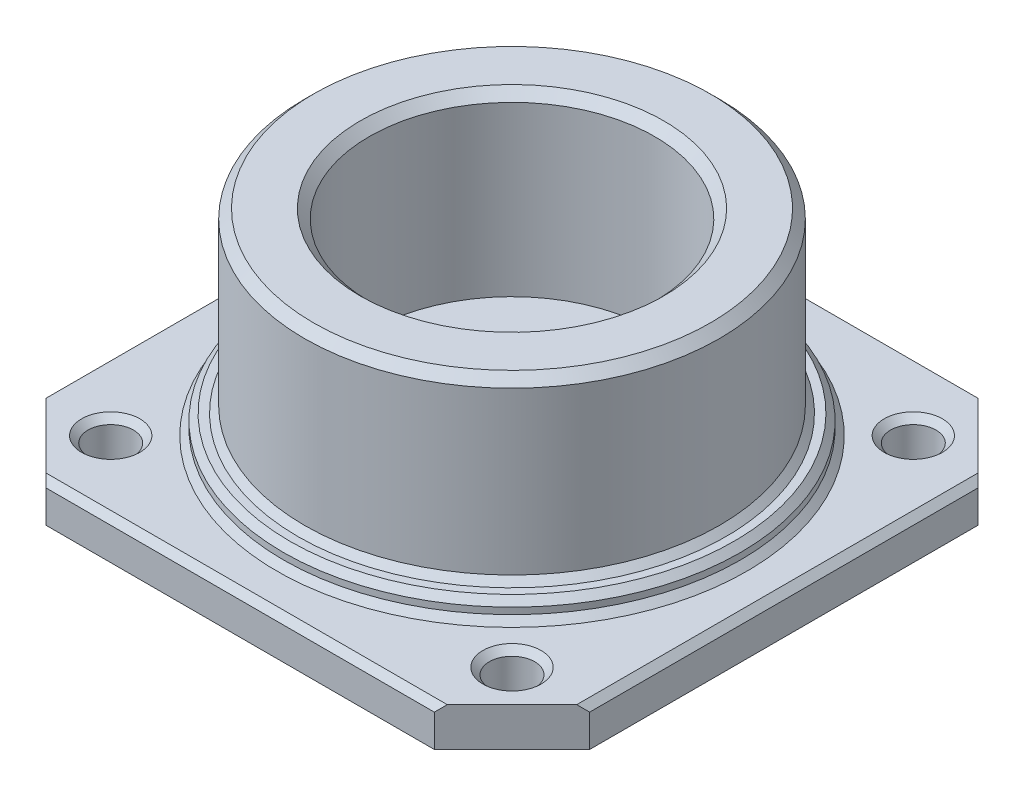
from build123d import *

# Parameters (mm, degrees)
SKETCH_1_W          = 42
SKETCH_1_H          = 42
SKETCH_1_R          = 12.65
SKETCH_1_R_2        = 1.75
EXTRUDE_1_DEPTH     = 2
SKETCH_2_R          = 17.65
SKETCH_2_R_2        = 12.65
EXTRUDE_2_DEPTH     = 0.1
SKETCH_3_R          = 17.65
SKETCH_3_R_2        = 12.65
SKETCH_3_R_3        = 11.025
SKETCH_3_R_4        = 3.95
EXTRUDE_3_DEPTH     = 1.4
SKETCH_4_R          = 16.025
SKETCH_4_R_2        = 11.025
EXTRUDE_4_DEPTH     = 14
CHAMFER_2_SIZE      = 0.5
CHAMFER_3_SIZE      = 1
CHAMFER_4_SIZE      = 6
SKETCH_5_W          = 78.516665661
SKETCH_5_H          = 56.486058674
CUT_EXTRUDE_1_DEPTH = 0.3
EXTRUDE_START       = 1
SKETCH_7_R          = 1.75
SKETCH_7_R_2        = 12.65
EXTRUDE_5_DEPTH     = 1


with BuildPart() as part:
    # 草图1 → 凸台-拉伸1 (new body)
    with BuildSketch(Plane(origin=(0, 0, 0), x_dir=(1, 0, 0), z_dir=(0, 1, 0))):
        Rectangle(SKETCH_1_W, SKETCH_1_H)
        with Locations(Location((0, 0, 0), (0, 0, 270))):
            Circle(SKETCH_1_R, mode=Mode.SUBTRACT)
        with Locations(Location((-15.5, 15.5, 0), (0, 0, 270))):
            Circle(SKETCH_1_R_2, mode=Mode.SUBTRACT)
        with Locations(Location((15.5, 15.5, 0), (0, 0, 270))):
            Circle(SKETCH_1_R_2, mode=Mode.SUBTRACT)
        with Locations(Location((15.5, -15.5, 0), (0, 0, 270))):
            Circle(SKETCH_1_R_2, mode=Mode.SUBTRACT)
        with Locations(Location((-15.5, -15.5, 0), (0, 0, 270))):
            Circle(SKETCH_1_R_2, mode=Mode.SUBTRACT)
    extrude(amount=EXTRUDE_1_DEPTH)

    # 草图2 → 凸台-拉伸2 (add)
    with BuildSketch(Plane(origin=(0, 2, 0), x_dir=(1, 0, 0), z_dir=(0, 1, 0))):
        with Locations(Location((0, 0, 0), (0, 0, 270))):
            Circle(SKETCH_2_R)
        with Locations(Location((0, 0, 0), (0, 0, 270))):
            Circle(SKETCH_2_R_2, mode=Mode.SUBTRACT)
    extrude(amount=EXTRUDE_2_DEPTH)

    # 草图3 → 凸台-拉伸3 (add)
    # profile 1 of 3: a face of its own
    with BuildSketch(Plane(origin=(0, 2.1, 0), x_dir=(1, 0, 0), z_dir=(0, 1, 0))):
        with Locations(Location((0, 0, 0), (0, 0, 270))):
            Circle(SKETCH_3_R)
        with Locations(Location((0, 0, 0), (0, 0, 270))):
            Circle(SKETCH_3_R_2, mode=Mode.SUBTRACT)
    # profile 2 of 3: a face of its own
    with BuildSketch(Plane(origin=(0, 2.1, 0), x_dir=(1, 0, 0), z_dir=(0, 1, 0))):
        with Locations(Location((0, 0, 0), (0, 0, 270))):
            Circle(SKETCH_3_R_2)
        Circle(SKETCH_3_R_3, mode=Mode.SUBTRACT)
    # profile 3 of 3: a face of its own
    with BuildSketch(Plane(origin=(0, 2.1, 0), x_dir=(1, 0, 0), z_dir=(0, 1, 0))):
        Circle(SKETCH_3_R_3)
        with Locations(Location((0, 0, 0), (0, 0, 270))):
            Circle(SKETCH_3_R_4, mode=Mode.SUBTRACT)
    extrude(amount=EXTRUDE_3_DEPTH)

    # 草图4 → 凸台-拉伸4 (add)
    with BuildSketch(Plane(origin=(0, 3.5, 0), x_dir=(1, 0, 0), z_dir=(0, 1, 0))):
        with Locations(Location((0, 0, 0), (0, 0, 270))):
            Circle(SKETCH_4_R)
        with Locations(Location((0, 0, 0), (0, 0, 270))):
            Circle(SKETCH_4_R_2, mode=Mode.SUBTRACT)
    extrude(amount=EXTRUDE_4_DEPTH)

    # 倒角2
    chamfer_2_edges = [part.edges().sort_by_distance(p)[0] for p in [
        (-21, 2, 0),
        (-15.5, 2, -17.25),
        (0, 2, 21),
        (15.5, 2, -17.25),
        (15.5, 2, 13.75),
        (-15.5, 2, 13.75),
        (0, 2, -17.65),
        (0, 2.1, -3.95),
        (0, 3.5, -3.95),
        (0, 3.5, -17.65),
        (0, 3.5, -16.025),
        (21, 2, 0),
        (0, 2, -21),
    ]]
    chamfer(chamfer_2_edges, length=CHAMFER_2_SIZE)

    # 倒角3
    chamfer_3_edges = [part.edges().sort_by_distance(p)[0] for p in [
        (0, 17.5, -11.025),
        (0, 17.5, -16.025),
    ]]
    chamfer(chamfer_3_edges, length=CHAMFER_3_SIZE)

    # 倒角4
    # the kernel refuses this chamfer: 6 mm, written as the material it takes off along each edge
    with BuildSketch(Plane(origin=(-21, -15.430097928, -21), x_dir=(-0.0274958766105862, 0, 0.9996219169112968), z_dir=(0, 1, 0)), Plane(origin=(21, -15.430097928, -21), x_dir=(-0.9996219169112969, 0, -0.027495876610586202), z_dir=(0, 1, 0))) as chamfer_4_piece_1:
        Polygon((CHAMFER_4_SIZE * 0.999621916911, CHAMFER_4_SIZE * 0.0274958766106), (-CHAMFER_4_SIZE * 0.0274958766106, CHAMFER_4_SIZE * 0.999621916911), (0, 0), align=None)
    extrude(amount=32.360195856, mode=Mode.SUBTRACT)
    with BuildSketch(Plane(origin=(-21, -15.430097928, 21), x_dir=(-0.0274958766105862, 0, -0.9996219169112968), z_dir=(0, 1, 0)), Plane(origin=(21, -15.430097928, 21), x_dir=(-0.9996219169112969, 0, 0.027495876610586202), z_dir=(0, 1, 0))) as chamfer_4_piece_2:
        Polygon((CHAMFER_4_SIZE * 0.999621916911, -CHAMFER_4_SIZE * 0.0274958766106), (-CHAMFER_4_SIZE * 0.0274958766106, -CHAMFER_4_SIZE * 0.999621916911), (0, 0), align=None)
    extrude(amount=32.360195856, mode=Mode.SUBTRACT)

    # 草图5 → 切除-拉伸1 (cut)
    with BuildSketch(Plane(origin=(0, 17.5, 0), x_dir=(1, 0, 0), z_dir=(0, 1, 0))):
        with Locations((8.405042003, -1.618362125)):
            Rectangle(SKETCH_5_W, SKETCH_5_H)
    extrude(amount=-CUT_EXTRUDE_1_DEPTH, mode=Mode.SUBTRACT)

    # 草图7 → 凸台-拉伸5 (add)
    with BuildSketch(Plane.XZ.offset(EXTRUDE_START)):
        Polygon((-21, 15), (-21, -15), (-15, -21), (15, -21), (21, -15), (21, 15), (15, 21), (-15, 21), align=None)
        with Locations(Location((15.5, 15.5, 0), (0, 0, 270))):
            Circle(SKETCH_7_R, mode=Mode.SUBTRACT)
        with Locations(Location((-15.5, 15.5, 0), (0, 0, 270))):
            Circle(SKETCH_7_R, mode=Mode.SUBTRACT)
        with Locations(Location((0, 0, 0), (0, 0, 270))):
            Circle(SKETCH_7_R_2, mode=Mode.SUBTRACT)
        with Locations(Location((15.5, -15.5, 0), (0, 0, 270))):
            Circle(SKETCH_7_R, mode=Mode.SUBTRACT)
        with Locations(Location((-15.5, -15.5, 0), (0, 0, 270))):
            Circle(SKETCH_7_R, mode=Mode.SUBTRACT)
    extrude(amount=-EXTRUDE_5_DEPTH)


solid = part.part
